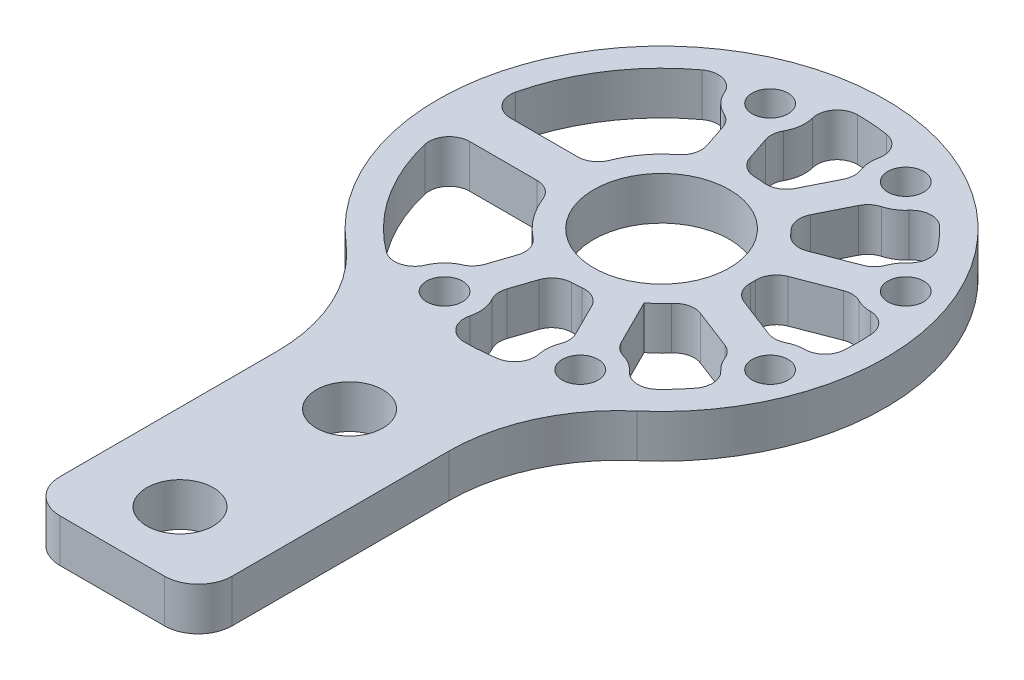
from build123d import *

# Parameters (mm, degrees)
BOSS_EXTRUDE1_DEPTH     = 6.35
SKETCH5_R               = 10
CUT_EXTRUDE1_DEPTH      = 88.694483863
F_3_8_CLEARANCE_HOLE1_D = 9.8044
FILLET1_R               = 25
M5_CLEARANCE_HOLE1_D    = 5.3
FILLET2_R               = 5
CUT_EXTRUDE2_DEPTH      = 10
FILLET3_R               = 3


with BuildPart() as part:
    # Sketch1 → Boss-Extrude1 (new body)
    with BuildSketch(Plane(origin=(0, 0, 0), x_dir=(1, 0, 0), z_dir=(0, 1, 0))):
        with BuildLine():
            Line((-12.7, -81), (12.7, -81))
            Line((12.7, -81), (12.7, -30.458332193))
            ThreePointArc((12.7, -30.458332193), (0, 33), (-12.7, -30.458332193))
            Line((-12.7, -30.458332193), (-12.7, -81))
        make_face()
    extrude(amount=BOSS_EXTRUDE1_DEPTH)

    # Sketch5 → Cut-Extrude1 (cut, through all)
    with BuildSketch(Plane.XZ):
        Circle(SKETCH5_R)
    extrude(amount=-CUT_EXTRUDE1_DEPTH, mode=Mode.SUBTRACT)

    # 3/8 Clearance Hole1 (through all)
    with Locations(Plane(origin=(0, 0, 0), x_dir=(-1, 0, 0), z_dir=(0, -1, 0))):
        with Locations((0, -46), (0, -71)):
            Hole(F_3_8_CLEARANCE_HOLE1_D / 2)

    # Fillet1
    fillet1_edges = [part.edges().sort_by_distance(p)[0] for p in [
        (-12.7, 3.175, 30.458332193),
        (12.7, 3.175, 30.458332193),
    ]]
    fillet(fillet1_edges, radius=FILLET1_R)

    # M5 Clearance Hole1 (through all)
    with Locations(Plane(origin=(0, 0, 0), x_dir=(-1, 0, 0), z_dir=(0, -1, 0))):
        with Locations((8, 24), (-12, 24), (-26, 10), (-26, -10), (-12, -24), (8, -24)):
            Hole(M5_CLEARANCE_HOLE1_D / 2)

    # Fillet2
    fillet2_edges = [part.edges().sort_by_distance(p)[0] for p in [
        (-12.7, 3.175, 81),
        (12.7, 3.175, 81),
    ]]
    fillet(fillet2_edges, radius=FILLET2_R)

    # Sketch20 → Cut-Extrude2 (cut)
    with BuildSketch(Plane(origin=(0, 6.35, 0), x_dir=(1, 0, 0), z_dir=(0, 1, 0))):
        with BuildLine():
            Line((-28.844410204, 3), (-13.162446581, 3))
            ThreePointArc((-13.162446581, 3), (-10.800500788, 8.09933224), (-6.566943638, 11.795136763))
            Line((-6.566943638, 11.795136763), (-8.947892948, 18.937984694))
            ThreePointArc((-8.947892948, 18.937984694), (-12.551540597, 21.590440248), (-12.71923684, 26.06186897))
            ThreePointArc((-12.71923684, 26.06186897), (-23.766502456, 16.617862709), (-28.844410204, 3))
        make_face()
        with BuildLine():
            ThreePointArc((-6.566943638, -11.795136763), (-10.800500788, -8.09933224), (-13.162446581, -3))
            Line((-13.162446581, -3), (-28.844410204, -3))
            ThreePointArc((-28.844410204, -3), (-23.766502456, -16.617862709), (-12.71923684, -26.06186897))
            ThreePointArc((-12.71923684, -26.06186897), (-12.551540597, -21.590440248), (-8.947892948, -18.937984694))
            Line((-8.947892948, -18.937984694), (-6.566943638, -11.795136763))
        make_face()
        with BuildLine():
            Line((-4.204476458, 20.519123524), (-1.823527148, 13.376275593))
            ThreePointArc((-1.823527148, 13.376275593), (0.957001771, 13.466036819), (3.696890812, 12.983951568))
            Line((3.696890812, 12.983951568), (7.750353119, 21.090876182))
            ThreePointArc((7.750353119, 21.090876182), (6.87897038, 24.545486599), (8.458507109, 27.739027695))
            ThreePointArc((8.458507109, 27.739027695), (1.543635305, 28.958887928), (-5.46173191, 28.48103728))
            ThreePointArc((-5.46173191, 28.48103728), (-2.913031672, 24.803276557), (-4.204476458, 20.519123524))
        make_face()
        with BuildLine():
            Line((12.222489074, 18.854808205), (8.169026767, 10.747883591))
            ThreePointArc((8.169026767, 10.747883591), (9.995125925, 9.074550002), (11.484781004, 7.09575967))
            Line((11.484781004, 7.09575967), (20.900164358, 10.71706096))
            ThreePointArc((20.900164358, 10.71706096), (22.193103711, 13.468434898), (24.812554008, 15.01123458))
            ThreePointArc((24.812554008, 15.01123458), (21.380812204, 19.592367634), (17.116117891, 23.410222305))
            ThreePointArc((17.116117891, 23.410222305), (15.509007051, 20.230468263), (12.222489074, 18.854808205))
        make_face()
        with BuildLine():
            Line((7.750353119, -21.090876182), (3.696890812, -12.983951568))
            ThreePointArc((3.696890812, -12.983951568), (0.957001771, -13.466036819), (-1.823527148, -13.376275593))
            Line((-1.823527148, -13.376275593), (-4.204476458, -20.519123524))
            ThreePointArc((-4.204476458, -20.519123524), (-2.913031672, -24.803276557), (-5.46173191, -28.48103728))
            ThreePointArc((-5.46173191, -28.48103728), (1.543635305, -28.958887928), (8.458507109, -27.739027695))
            ThreePointArc((8.458507109, -27.739027695), (6.87897038, -24.545486599), (7.750353119, -21.090876182))
        make_face()
        with BuildLine():
            ThreePointArc((11.484781004, -7.09575967), (9.995125925, -9.074550002), (8.169026767, -10.747883591))
            Line((8.169026767, -10.747883591), (12.222489074, -18.854808205))
            ThreePointArc((12.222489074, -18.854808205), (15.509007051, -20.230468263), (17.116117891, -23.410222305))
            ThreePointArc((17.116117891, -23.410222305), (21.380812204, -19.592367634), (24.812554008, -15.01123458))
            ThreePointArc((24.812554008, -15.01123458), (22.193103711, -13.468434898), (20.900164358, -10.71706096))
            Line((20.900164358, -10.71706096), (11.484781004, -7.09575967))
        make_face()
        with BuildLine():
            Line((22.695059754, 6.050332929), (13.2796764, 2.429031639))
            ThreePointArc((13.2796764, 2.429031639), (13.5, 0), (13.2796764, -2.429031639))
            Line((13.2796764, -2.429031639), (22.695059754, -6.050332929))
            ThreePointArc((22.695059754, -6.050332929), (25.4984715, -4.874478645), (28.47664058, -5.484609492))
            ThreePointArc((28.47664058, -5.484609492), (29, 0), (28.47664058, 5.484609492))
            ThreePointArc((28.47664058, 5.484609492), (25.4984715, 4.874478645), (22.695059754, 6.050332929))
        make_face()
    extrude(amount=-CUT_EXTRUDE2_DEPTH, mode=Mode.SUBTRACT)

    # Fillet3
    fillet3_edges = [part.edges().sort_by_distance(p)[0] for p in [
        (-28.844410204, 3.175, -3),
        (-13.162446581, 3.175, -3),
        (-6.566943638, 3.175, -11.795136763),
        (-8.947892948, 3.175, -18.937984694),
        (-12.71923684, 3.175, -26.06186897),
        (-5.46173191, 3.175, -28.48103728),
        (-4.204476458, 3.175, -20.519123524),
        (8.458507109, 3.175, -27.739027695),
        (7.750353119, 3.175, -21.090876182),
        (-1.823527148, 3.175, -13.376275593),
        (3.696890812, 3.175, -12.983951568),
        (11.484781004, 3.175, -7.09575967),
        (8.169026767, 3.175, -10.747883591),
        (20.900164358, 3.175, -10.71706096),
        (24.812554008, 3.175, -15.01123458),
        (12.222489074, 3.175, -18.854808205),
        (17.116117891, 3.175, -23.410222305),
        (13.2796764, 3.175, 2.429031639),
        (13.2796764, 3.175, -2.429031639),
        (22.695059754, 3.175, 6.050332929),
        (28.47664058, 3.175, 5.484609492),
        (28.47664058, 3.175, -5.484609492),
        (22.695059754, 3.175, -6.050332929),
        (24.812554008, 3.175, 15.01123458),
        (20.900164358, 3.175, 10.71706096),
        (11.484781004, 3.175, 7.09575967),
        (-6.566943638, 3.175, 11.795136763),
        (-28.844410204, 3.175, 3),
        (-13.162446581, 3.175, 3),
        (3.696890812, 3.175, 12.983951568),
        (-1.823527148, 3.175, 13.376275593),
        (17.116117891, 3.175, 23.410222305),
        (12.222489074, 3.175, 18.854808205),
        (7.750353119, 3.175, 21.090876182),
        (8.458507109, 3.175, 27.739027695),
        (-12.71923684, 3.175, 26.06186897),
        (-8.947892948, 3.175, 18.937984694),
        (-4.204476458, 3.175, 20.519123524),
        (-5.46173191, 3.175, 28.48103728),
    ]]
    fillet(fillet3_edges, radius=FILLET3_R)


solid = part.part
